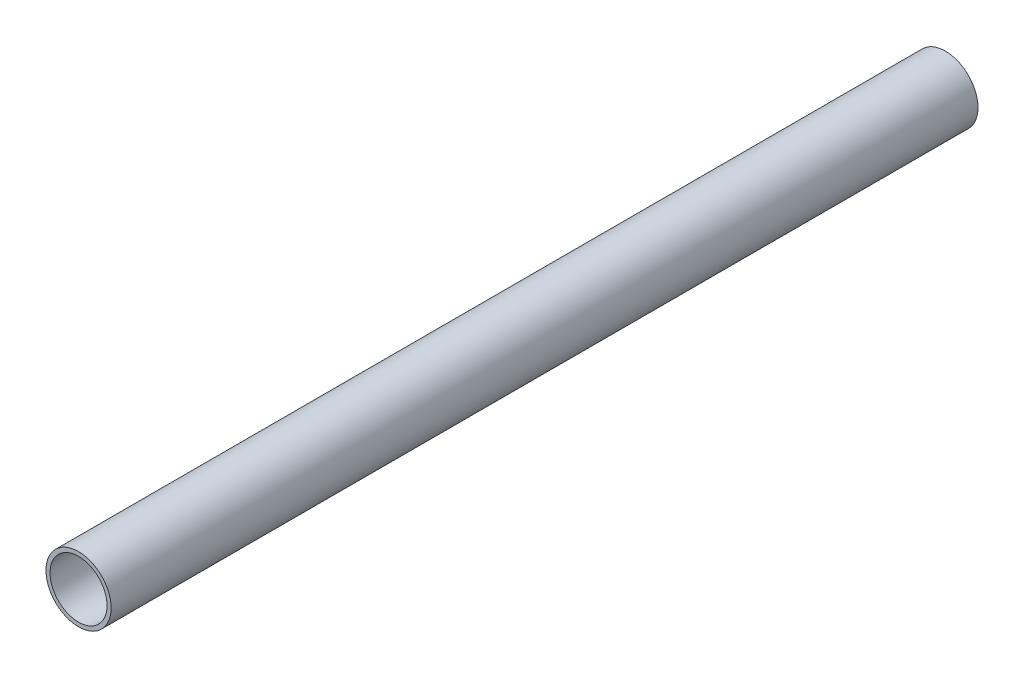
from build123d import *

# Parameters (mm, degrees)
SKETCH1_R           = 12.7
SKETCH1_R_2         = 11.1125
BOSS_EXTRUDE1_DEPTH = 337.9


with BuildPart() as part:
    # Sketch1 → Boss-Extrude1 (new body)
    with BuildSketch(Plane.XY):
        Circle(SKETCH1_R)
        Circle(SKETCH1_R_2, mode=Mode.SUBTRACT)
    extrude(amount=BOSS_EXTRUDE1_DEPTH)


solid = part.part
